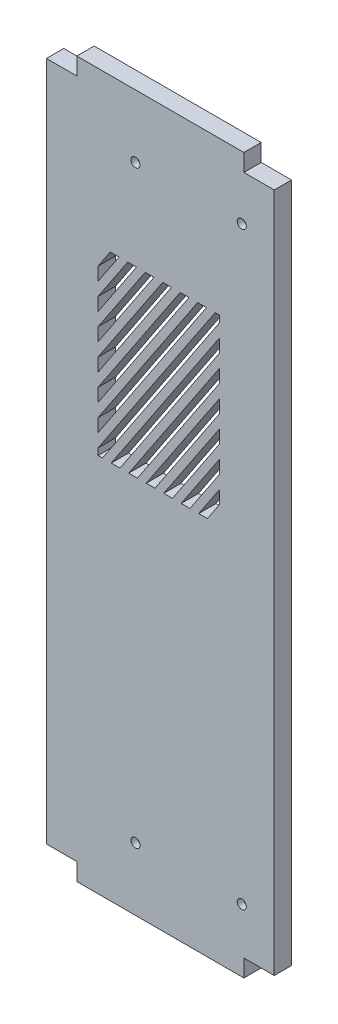
from build123d import *

# Parameters (mm, degrees)
SKETCH1_W           = 75
SKETCH1_H           = 235.4
BOSS_EXTRUDE1_DEPTH = 5.7
SKETCH2_W           = 10
SKETCH2_H           = 5.7
CUT_EXTRUDE1_DEPTH  = 5.7
CUT_EXTRUDE2_DEPTH  = 5.7
SKETCH4_R           = 1.5
CUT_EXTRUDE3_DEPTH  = 2


with BuildPart() as part:
    # Sketch1 → Boss-Extrude1 (new body)
    with BuildSketch(Plane.XY):
        with Locations((37.5, 117.7)):
            Rectangle(SKETCH1_W, SKETCH1_H)
    extrude(amount=BOSS_EXTRUDE1_DEPTH)

    # Sketch2 → Cut-Extrude1 (cut)
    with BuildSketch(Plane(origin=(0, 0, 0), x_dir=(-1, 0, 0), z_dir=(0, 0, -1))):
        with Locations((-70, 2.85)):
            Rectangle(SKETCH2_W, SKETCH2_H)
        with Locations((-5, 2.85)):
            Rectangle(SKETCH2_W, SKETCH2_H)
        with Locations((-5, 232.55)):
            Rectangle(SKETCH2_W, SKETCH2_H)
        with Locations((-70, 232.55)):
            Rectangle(SKETCH2_W, SKETCH2_H)
    extrude(amount=-CUT_EXTRUDE1_DEPTH, mode=Mode.SUBTRACT)

    # Sketch3 → Cut-Extrude2 (cut)
    with BuildSketch(Plane.XY.offset(5.7)):
        Polygon((23.87777949, 185), (20.99777949, 185), (17, 179.003330765), (17, 174.683330765), align=None)
        Polygon((29.63777949, 185), (26.75777949, 185), (17, 170.363330765), (17, 166.043330765), align=None)
        Polygon((35.39777949, 185), (32.51777949, 185), (17, 161.723330765), (17, 157.403330765), align=None)
        Polygon((41.15777949, 185), (38.27777949, 185), (17, 153.083330765), (17, 148.763330765), align=None)
        Polygon((46.91777949, 185), (44.03777949, 185), (17, 144.443330765), (17, 140.123330765), align=None)
        Polygon((52.67777949, 185), (49.79777949, 185), (17, 135.803330765), (17, 131.483330765), align=None)
        Polygon((57, 185), (55.55777949, 185), (17, 127.163330765), (17, 125), (18.44222051, 125), (57, 182.836669235), align=None)
        Polygon((57, 174.196669235), (57, 178.516669235), (21.32222051, 125), (24.20222051, 125), align=None)
        Polygon((57, 165.556669235), (57, 169.876669235), (27.08222051, 125), (29.96222051, 125), align=None)
        Polygon((57, 156.916669235), (57, 161.236669235), (32.84222051, 125), (35.72222051, 125), align=None)
        Polygon((57, 148.276669235), (57, 152.596669235), (38.60222051, 125), (41.48222051, 125), align=None)
        Polygon((57, 139.636669235), (57, 143.956669235), (44.36222051, 125), (47.24222051, 125), align=None)
        Polygon((57, 130.996669235), (57, 135.316669235), (50.12222051, 125), (53.00222051, 125), align=None)
    extrude(amount=-CUT_EXTRUDE2_DEPTH, mode=Mode.SUBTRACT)

    # Sketch4 → Cut-Extrude3 (cut)
    with BuildSketch(Plane.XY.offset(5.7)):
        with Locations((64.3, 20.7)):
            Circle(SKETCH4_R)
        with Locations((29.3, 20.7)):
            Circle(SKETCH4_R)
        with Locations((64.3, 214.7)):
            Circle(SKETCH4_R)
        with Locations((29.3, 214.7)):
            Circle(SKETCH4_R)
    extrude(amount=-CUT_EXTRUDE3_DEPTH, mode=Mode.SUBTRACT)


solid = part.part
